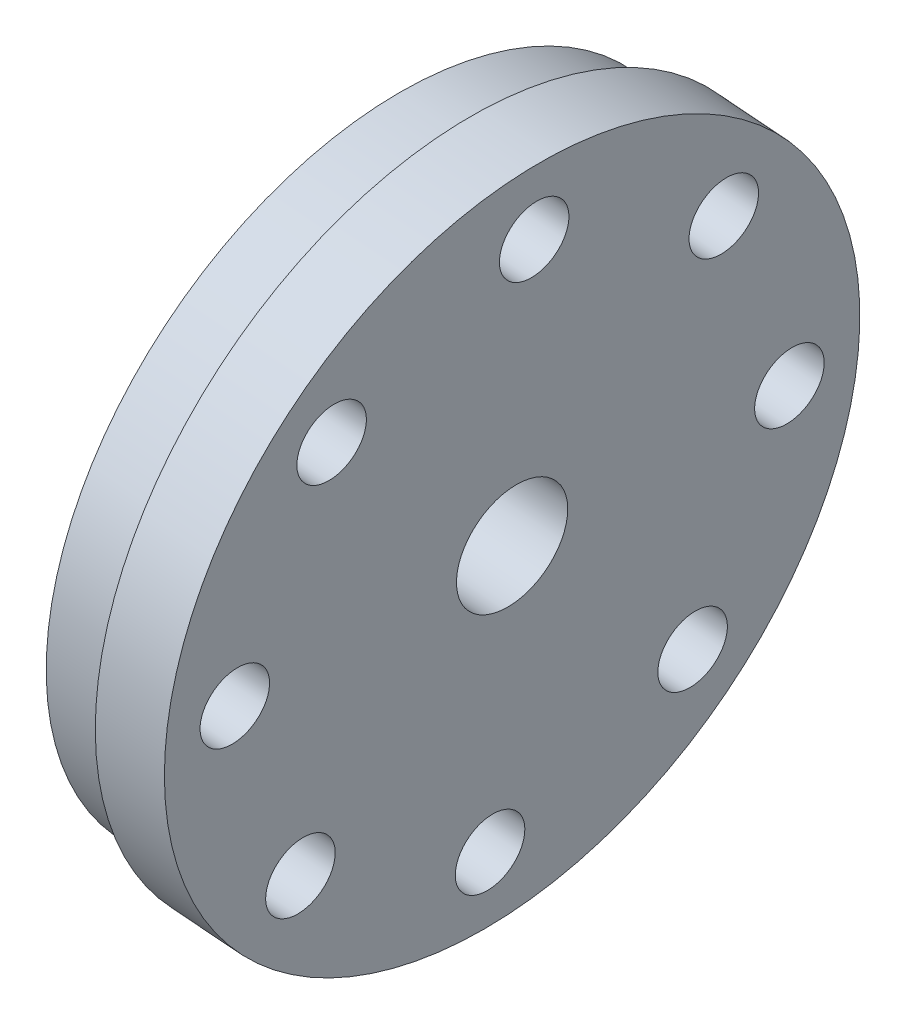
from build123d import *

# Parameters (mm, degrees)
SKETCH1_R           = 14.9606
BOSS_EXTRUDE1_DEPTH = 6.35
SKETCH2_R           = 2.54
CUT_EXTRUDE1_DEPTH  = 6.35
SKETCH3_R           = 1.5875
CUT_EXTRUDE2_DEPTH  = 10
SKETCH5_R           = 15.875
SKETCH5_R_2         = 14.9606
BOSS_EXTRUDE2_DEPTH = 3.175


with BuildPart() as part:
    # Sketch1 → Boss-Extrude1 (new body)
    with BuildSketch(Plane(origin=(234.278878836, -18.689027227, 0), x_dir=(0, 0, -1), z_dir=(0.9968332748770866, -0.0795199477981641, 0))):
        with Locations((-43.174261814, 8.550344032)):
            Circle(SKETCH1_R)
    extrude(amount=-BOSS_EXTRUDE1_DEPTH)

    # Sketch2 → Cut-Extrude1 (cut)
    with BuildSketch(Plane(origin=(234.278878836, -18.689027227, 0), x_dir=(0, 0, -1), z_dir=(0.9968332748770866, -0.07951994779816411, 0))):
        with Locations((-43.174261814, 8.550344032)):
            Circle(SKETCH2_R)
    extrude(amount=-CUT_EXTRUDE1_DEPTH, mode=Mode.SUBTRACT)

    # Sketch3 → Cut-Extrude2 (cut)
    with BuildSketch(Plane(origin=(227.94898754, -18.184075559, 0), x_dir=(0, 0, 1), z_dir=(-0.9968332748770866, 0.07951994779816411, 0))):
        with Locations((43.174261814, 21.250344032)):
            Circle(SKETCH3_R)
        with Locations((52.154517935, 17.530600153)):
            Circle(SKETCH3_R)
        with Locations((55.874261814, 8.550344032)):
            Circle(SKETCH3_R)
        with Locations((52.154517935, -0.429912089)):
            Circle(SKETCH3_R)
        with Locations((43.174261814, -4.149655968)):
            Circle(SKETCH3_R)
        with Locations((34.194005693, -0.429912089)):
            Circle(SKETCH3_R)
        with Locations((30.474261814, 8.550344032)):
            Circle(SKETCH3_R)
        with Locations((34.194005693, 17.530600153)):
            Circle(SKETCH3_R)
    extrude(amount=-CUT_EXTRUDE2_DEPTH, mode=Mode.SUBTRACT)

    # Sketch5 → Boss-Extrude2 (add)
    with BuildSketch(Plane(origin=(234.278878836, -18.689027227, 0), x_dir=(0, 0, 1), z_dir=(-0.9968332748770866, 0.07951994779816411, 0))):
        with Locations((43.174261814, 8.550344032)):
            Circle(SKETCH5_R)
        with Locations((43.174261814, 8.550344032)):
            Circle(SKETCH5_R_2, mode=Mode.SUBTRACT)
    extrude(amount=BOSS_EXTRUDE2_DEPTH)


solid = part.part
